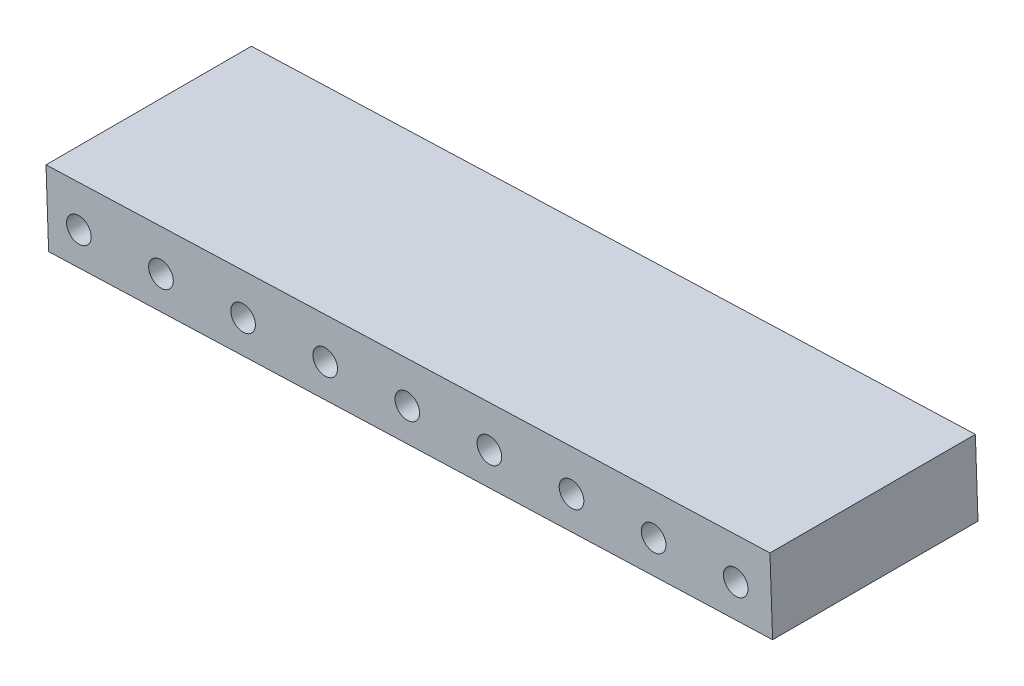
from build123d import *
from build123d.topology import SkipClean

# Parameters (mm, degrees)
EXTRUDE_3_DEPTH           = 5
SKETCH_4_R                = 1.5
SKETCH_4_R_2              = 4
CUT_EXTRUDE_3_DEPTH       = 5
SKETCH_5_R                = 11
CUT_EXTRUDE_4_DEPTH       = 2
SKETCH_6_R                = 1.5
CUT_EXTRUDE_6_DEPTH       = 169.745370307
SKETCH_7_R                = 1.5
CUT_EXTRUDE_7_DEPTH       = 10
SKETCH_8_R                = 11
CUT_EXTRUDE_8_DEPTH       = 10
SKETCH_9_R                = 1.5
CUT_EXTRUDE_9_DEPTH       = 10
SKETCH_10_R               = 5
CUT_EXTRUDE_10_DEPTH      = 10
SKETCH_11_R               = 1.5
SKETCH_11_R_2             = 2
CUT_EXTRUDE_11_DEPTH      = 10
SKETCH_12_W               = 41
SKETCH_12_H               = 22
CUT_EXTRUDE_12_DEPTH      = 10
SKETCH_13_R               = 1.5
CUT_EXTRUDE_13_DEPTH      = 10
EXTRUDE_4_DEPTH           = 5
SKETCH_15_R               = 1.5
EXTRUDE_6_DEPTH           = 5
SKETCH_16_R               = 1.5
CUT_EXTRUDE_14_DEPTH      = 5
EXTRUDE_7_DEPTH           = 5
CUT_EXTRUDE_15_DEPTH      = 5
CUT_EXTRUDE_19_DEPTH      = 5
SKETCH_21_R               = 1.5
CUT_EXTRUDE_20_DEPTH      = 5
EXTRUDE_8_DEPTH           = 10
SKETCH_23_R               = 1.5
CUT_EXTRUDE_21_DEPTH      = 15
CUT_EXTRUDE_25_DEPTH      = 138.493760399
CUT_EXTRUDE_25_DEPTH_BACK = 138.493760399
SKETCH_24_W               = 0.175432459
SKETCH_24_H               = 19.473002918
SKETCH_24_W_2             = 262.974480033
SKETCH_24_H_2             = 55.221701651
SKETCH_25_R               = 1.5
EXTRUDE_9_DEPTH           = 10
CUT_EXTRUDE_28_DEPTH      = 139.940757694
CUT_EXTRUDE_28_DEPTH_BACK = 139.940757694
SKETCH_26_R               = 1.5
CUT_EXTRUDE_29_DEPTH      = 25


with BuildPart() as part:
    # 草图1 → 凸台-拉伸3 (new body)
    with BuildSketch(Plane.XY):
        with BuildLine():
            Line((140, 25), (0, 35))
            ThreePointArc((0, 35), (-35, 0), (0, -35))
            Line((0, -35), (140, -25))
            ThreePointArc((140, -25), (165, 0), (140, 25))
        make_face()
    extrude(amount=EXTRUDE_3_DEPTH)

    # 草图4 → 切除-拉伸3 (cut)
    with BuildSketch(Plane.XY.offset(5)):
        with Locations((-5, -5)):
            Circle(SKETCH_4_R)
        with Locations((5, -5)):
            Circle(SKETCH_4_R)
        with Locations((-5, 5)):
            Circle(SKETCH_4_R)
        with Locations((5, 5)):
            Circle(SKETCH_4_R)
        with Locations((135, -5)):
            Circle(SKETCH_4_R)
        with Locations((145, -5)):
            Circle(SKETCH_4_R)
        with Locations((135, 5)):
            Circle(SKETCH_4_R)
        with Locations((145, 5)):
            Circle(SKETCH_4_R)
        Circle(SKETCH_4_R_2)
        with Locations((140, 0)):
            Circle(SKETCH_4_R_2)
    extrude(amount=-CUT_EXTRUDE_3_DEPTH, mode=Mode.SUBTRACT)

    # 草图5 → 切除-拉伸4 (cut)
    with BuildSketch(Plane.XY.offset(5)):
        Circle(SKETCH_5_R)
        with Locations((140, 0)):
            Circle(SKETCH_5_R)
    extrude(amount=-CUT_EXTRUDE_4_DEPTH, mode=Mode.SUBTRACT)

    # 草图6 → 切除-拉伸6 (cut, through all)
    with BuildSketch(Plane.XY.offset(5)):
        with Locations((30, 0)):
            Circle(SKETCH_6_R)
        with Locations((25.980762114, 15)):
            Circle(SKETCH_6_R)
        with Locations((25.980762114, -15)):
            Circle(SKETCH_6_R)
        with Locations((15, 25.980762114)):
            Circle(SKETCH_6_R)
        with Locations((15, -25.980762114)):
            Circle(SKETCH_6_R)
        with Locations((0, 30)):
            Circle(SKETCH_6_R)
        with Locations((0, -30)):
            Circle(SKETCH_6_R)
        with Locations((-15, 25.980762114)):
            Circle(SKETCH_6_R)
        with Locations((-15, -25.980762114)):
            Circle(SKETCH_6_R)
        with Locations((-25.980762114, 15)):
            Circle(SKETCH_6_R)
        with Locations((-25.980762114, -15)):
            Circle(SKETCH_6_R)
        with Locations((-30, 0)):
            Circle(SKETCH_6_R)
        with Locations((160, 0)):
            Circle(SKETCH_6_R)
        with Locations((157.320508076, 10)):
            Circle(SKETCH_6_R)
        with Locations((157.320508076, -10)):
            Circle(SKETCH_6_R)
        with Locations((150, 17.320508076)):
            Circle(SKETCH_6_R)
        with Locations((150, -17.320508076)):
            Circle(SKETCH_6_R)
        with Locations((140, 20)):
            Circle(SKETCH_6_R)
        with Locations((140, -20)):
            Circle(SKETCH_6_R)
        with Locations((130, 17.320508076)):
            Circle(SKETCH_6_R)
        with Locations((130, -17.320508076)):
            Circle(SKETCH_6_R)
        with Locations((122.679491924, 10)):
            Circle(SKETCH_6_R)
        with Locations((122.679491924, -10)):
            Circle(SKETCH_6_R)
        with Locations((120, 0)):
            Circle(SKETCH_6_R)
    extrude(amount=-CUT_EXTRUDE_6_DEPTH, mode=Mode.SUBTRACT)

    # 草图7 → 切除-拉伸7 (cut)
    with SkipClean():  # the faces are left unmerged after this step: merging them gives an invalid solid
        with BuildSketch(Plane.XY.offset(5)):
            with BuildLine():
                ThreePointArc((138.21656051, 24.936305732), (139.107711737, 24.984071359), (140, 25))
                Line((140, 25), (0, 35))
                ThreePointArc((0, 35), (-35, 0), (0, -35))
                Line((0, -35), (140, -25))
                ThreePointArc((140, -25), (139.107711737, -24.984071359), (138.21656051, -24.936305732))
                Line((138.21656051, -24.936305732), (0, -20))
                ThreePointArc((0, -20), (-20, 0), (0, 20))
                Line((0, 20), (138.21656051, 24.936305732))
            make_face()
            with Locations((0, -30)):
                Circle(SKETCH_7_R, mode=Mode.SUBTRACT)
            with Locations((-15, -25.980762114)):
                Circle(SKETCH_7_R, mode=Mode.SUBTRACT)
            with Locations((15, -25.980762114)):
                Circle(SKETCH_7_R, mode=Mode.SUBTRACT)
            with Locations((-25.980762114, -15)):
                Circle(SKETCH_7_R, mode=Mode.SUBTRACT)
            with Locations((-30, 0)):
                Circle(SKETCH_7_R, mode=Mode.SUBTRACT)
            with Locations((-25.980762114, 15)):
                Circle(SKETCH_7_R, mode=Mode.SUBTRACT)
            with Locations((-15, 25.980762114)):
                Circle(SKETCH_7_R, mode=Mode.SUBTRACT)
            with Locations((0, 30)):
                Circle(SKETCH_7_R, mode=Mode.SUBTRACT)
            with Locations((15, 25.980762114)):
                Circle(SKETCH_7_R, mode=Mode.SUBTRACT)
        extrude(amount=-CUT_EXTRUDE_7_DEPTH, mode=Mode.SUBTRACT)

    # 草图8 → 切除-拉伸8 (cut)
    with SkipClean():  # the faces are left unmerged after this step: merging them gives an invalid solid
        with BuildSketch(Plane.XY.offset(5)):
            Circle(SKETCH_8_R)
        extrude(amount=-CUT_EXTRUDE_8_DEPTH, mode=Mode.SUBTRACT)

    # 草图9 → 切除-拉伸9 (cut)
    with SkipClean():  # the faces are left unmerged after this step: merging them gives an invalid solid
        with BuildSketch(Plane.XY.offset(5)):
            with Locations((15, 0)):
                Circle(SKETCH_9_R)
            with Locations((10.606601718, 10.606601718)):
                Circle(SKETCH_9_R)
            with Locations((10.606601718, -10.606601718)):
                Circle(SKETCH_9_R)
            with Locations((0, 15)):
                Circle(SKETCH_9_R)
            with Locations((0, -15)):
                Circle(SKETCH_9_R)
            with Locations((-10.606601718, 10.606601718)):
                Circle(SKETCH_9_R)
            with Locations((-10.606601718, -10.606601718)):
                Circle(SKETCH_9_R)
            with Locations((-15, 0)):
                Circle(SKETCH_9_R)
        extrude(amount=-CUT_EXTRUDE_9_DEPTH, mode=Mode.SUBTRACT)

    # 草图10 → 切除-拉伸10 (cut)
    with SkipClean():  # the faces are left unmerged after this step: merging them gives an invalid solid
        with BuildSketch(Plane.XY.offset(3)):
            with Locations((140, 0)):
                Circle(SKETCH_10_R)
        extrude(amount=-CUT_EXTRUDE_10_DEPTH, mode=Mode.SUBTRACT)

    # 草图11 → 切除-拉伸11 (cut)
    # profile 1 of 5: a face of its own
    with SkipClean():  # the faces are left unmerged after this step: merging them gives an invalid solid
        with BuildSketch(Plane.XY.offset(5)):
            with BuildLine():
                Line((124.179491924, -10), (150, -10))
                Line((150, -10), (150, 10))
                Line((150, 10), (124.179491924, 10))
                ThreePointArc((124.179491924, 10), (122.679491924, 8.5), (121.179491924, 10))
                Line((121.179491924, 10), (110, 10))
                Line((110, 10), (110, -10))
                Line((110, -10), (121.179491924, -10))
                ThreePointArc((121.179491924, -10), (122.679491924, -8.5), (124.179491924, -10))
            make_face()
            with Locations((120, 0)):
                Circle(SKETCH_11_R, mode=Mode.SUBTRACT)
        # profile 2 of 5: a face of its own
        with BuildSketch(Plane.XY.offset(5)):
            with Locations((105.5, 5)):
                Circle(SKETCH_11_R_2)
        # profile 3 of 5: a face of its own
        with BuildSketch(Plane.XY.offset(5)):
            with Locations((105.5, -5)):
                Circle(SKETCH_11_R_2)
        # profile 4 of 5: a face of its own
        with BuildSketch(Plane.XY.offset(5)):
            with Locations((154.5, -5)):
                Circle(SKETCH_11_R_2)
        # profile 5 of 5: a face of its own
        with BuildSketch(Plane.XY.offset(5)):
            with Locations((154.5, 5)):
                Circle(SKETCH_11_R_2)
        extrude(amount=-CUT_EXTRUDE_11_DEPTH, mode=Mode.SUBTRACT)

    # 草图12 → 切除-拉伸12 (cut)
    with SkipClean():  # the faces are left unmerged after this step: merging them gives an invalid solid
        with BuildSketch(Plane.XY.offset(5)):
            with Locations((130, 0)):
                Rectangle(SKETCH_12_W, SKETCH_12_H)
        extrude(amount=-CUT_EXTRUDE_12_DEPTH, mode=Mode.SUBTRACT)

    # 草图13 → 切除-拉伸13 (cut)
    with SkipClean():  # the faces are left unmerged after this step: merging them gives an invalid solid
        with BuildSketch(Plane.XY.offset(5)):
            with BuildLine():
                ThreePointArc((129.008722028, -18.446282468), (129.863637935, -21.138943397), (130.908449037, -18.514124575))
                ThreePointArc((130.908449037, -18.514124575), (129.94646687, -18.819552506), (129.008722028, -18.446282468))
            make_face()
            with Locations((119.923542522, -19.282983661)):
                Circle(SKETCH_13_R)
            with Locations((109.929913978, -18.926068356)):
                Circle(SKETCH_13_R)
            with Locations((99.936285435, -18.569153051)):
                Circle(SKETCH_13_R)
            with Locations((89.942656891, -18.212237746)):
                Circle(SKETCH_13_R)
            with Locations((79.949028348, -17.855322441)):
                Circle(SKETCH_13_R)
            with Locations((69.955399804, -17.498407136)):
                Circle(SKETCH_13_R)
            with Locations((59.961771261, -17.141491831)):
                Circle(SKETCH_13_R)
            with Locations((49.968142717, -16.784576526)):
                Circle(SKETCH_13_R)
            with Locations((39.974514174, -16.42766122)):
                Circle(SKETCH_13_R)
            with Locations((29.98088563, -16.070745915)):
                Circle(SKETCH_13_R)
            with Locations((19.987257087, -15.71383061)):
                Circle(SKETCH_13_R)
            with Locations((9.993628543, -15.356915305)):
                Circle(SKETCH_13_R)
        extrude(amount=-CUT_EXTRUDE_13_DEPTH, mode=Mode.SUBTRACT)

    # 草图14 → 凸台-拉伸4 (add)
    with SkipClean():  # the faces are left unmerged after this step: merging them gives an invalid solid
        with BuildSketch(Plane.XY.offset(5)):
            with BuildLine():
                ThreePointArc((130.908449037, -18.514124575), (131.344000289, -17.986588568), (131.5, -17.320508076))
                ThreePointArc((131.5, -17.320508076), (129.382309527, -15.953592395), (129.008722028, -18.446282468))
                ThreePointArc((129.008722028, -18.446282468), (129.970704195, -18.140854536), (130.908449037, -18.514124575))
            make_face()
        extrude(amount=-EXTRUDE_4_DEPTH)

    # 草图15 → 凸台-拉伸6 (add)
    with SkipClean():  # the faces are left unmerged after this step: merging them gives an invalid solid
        with BuildSketch(Plane.XY.offset(5)):
            with Locations((25.980762114, 15)):
                Circle(SKETCH_15_R)
            with Locations((30, 0)):
                Circle(SKETCH_15_R)
            with Locations((25.980762114, -15)):
                Circle(SKETCH_15_R)
        extrude(amount=-EXTRUDE_6_DEPTH)

    # 草图16 → 切除-拉伸14 (cut)
    with SkipClean():  # the faces are left unmerged after this step: merging them gives an invalid solid
        with BuildSketch(Plane.XY.offset(5)):
            with Locations((129.917171065, 19.639898967)):
                Circle(SKETCH_16_R)
            with Locations((119.923542522, 19.282983661)):
                Circle(SKETCH_16_R)
            with Locations((109.929913978, 18.926068356)):
                Circle(SKETCH_16_R)
            with Locations((99.936285435, 18.569153051)):
                Circle(SKETCH_16_R)
            with Locations((89.942656891, 18.212237746)):
                Circle(SKETCH_16_R)
            with Locations((79.949028348, 17.855322441)):
                Circle(SKETCH_16_R)
            with Locations((69.955399804, 17.498407136)):
                Circle(SKETCH_16_R)
            with Locations((59.961771261, 17.141491831)):
                Circle(SKETCH_16_R)
            with Locations((49.968142717, 16.784576526)):
                Circle(SKETCH_16_R)
            with Locations((39.974514174, 16.42766122)):
                Circle(SKETCH_16_R)
            with Locations((29.98088563, 16.070745915)):
                Circle(SKETCH_16_R)
            with Locations((19.987257087, 15.71383061)):
                Circle(SKETCH_16_R)
            with Locations((9.993628543, 15.356915305)):
                Circle(SKETCH_16_R)
        extrude(amount=-CUT_EXTRUDE_14_DEPTH, mode=Mode.SUBTRACT)

    # 草图17 → 凸台-拉伸7 (add)
    with SkipClean():  # the faces are left unmerged after this step: merging them gives an invalid solid
        with BuildSketch(Plane.XY.offset(5)):
            with BuildLine():
                ThreePointArc((129.008722028, 18.446282468), (129.382309527, 15.953592395), (131.5, 17.320508076))
                ThreePointArc((131.5, 17.320508076), (131.344000289, 17.986588568), (130.908449037, 18.514124575))
                ThreePointArc((130.908449037, 18.514124575), (129.970704195, 18.140854536), (129.008722028, 18.446282468))
            make_face()
        extrude(amount=-EXTRUDE_7_DEPTH)

    # 草图18 → 切除-拉伸15 (cut)
    with SkipClean():  # the faces are left unmerged after this step: merging them gives an invalid solid
        with BuildSketch(Plane.XY.offset(5)):
            with BuildLine():
                ThreePointArc((100, 0), (99.769776761, 6.781714021), (99.080167099, 13.532201878))
                Line((99.080167099, 13.532201878), (22.547372848, 10.798887797))
                ThreePointArc((22.547372848, 10.798887797), (24.379133713, 5.536952176), (25, 0))
                ThreePointArc((25, 0), (24.379133713, -5.536952176), (22.547372848, -10.798887797))
                Line((22.547372848, -10.798887797), (99.080167099, -13.532201878))
                ThreePointArc((99.080167099, -13.532201878), (99.769776761, -6.781714021), (100, 0))
            make_face()
        extrude(amount=-CUT_EXTRUDE_15_DEPTH, mode=Mode.SUBTRACT)

    # 草图19 → 切除-拉伸19 (cut)
    with SkipClean():  # the faces are left unmerged after this step: merging them gives an invalid solid
        with BuildSketch(Plane.XY.offset(5)):
            with BuildLine():
                Line((134.406294114, 15.794486823), (16.308878209, 11.576721969))
                Line((16.308878209, 11.576721969), (15.987654435, 20.570987658))
                Line((15.987654435, 20.570987658), (0, 20))
                ThreePointArc((0, 20), (-20, 0), (0, -20))
                Line((0, -20), (15.987654435, -20.570987658))
                Line((15.987654435, -20.570987658), (16.308878209, -11.576721969))
                Line((16.308878209, -11.576721969), (134.406294114, -15.794486823))
                ThreePointArc((134.406294114, -15.794486823), (156.755756012, 0), (134.406294114, 15.794486823))
            make_face()
        extrude(amount=-CUT_EXTRUDE_19_DEPTH, mode=Mode.SUBTRACT)

    # 草图21 → 切除-拉伸20 (cut)
    with SkipClean():  # the faces are left unmerged after this step: merging them gives an invalid solid
        with BuildSketch(Plane.XY.offset(5)):
            with BuildLine():
                ThreePointArc((134.406294114, 15.794486823), (146.604776394, 15.399100244), (155.298987649, 6.833471771))
                ThreePointArc((155.298987649, 6.833471771), (156.390745963, 5.651981367), (156.259259804, 4.048682523))
                ThreePointArc((156.259259804, 4.048682523), (156.755756012, 0), (156.259259804, -4.048682523))
                ThreePointArc((156.259259804, -4.048682523), (156.390745963, -5.651981367), (155.298987649, -6.833471771))
                ThreePointArc((155.298987649, -6.833471771), (146.604776394, -15.399100244), (134.406294114, -15.794486823))
                Line((134.406294114, -15.794486823), (134.08507034, -24.788752512))
                Line((134.08507034, -24.788752512), (138.21656051, -24.936305732))
                ThreePointArc((138.21656051, -24.936305732), (165, 0), (138.21656051, 24.936305732))
                Line((138.21656051, 24.936305732), (134.08507034, 24.788752512))
                Line((134.08507034, 24.788752512), (134.406294114, 15.794486823))
            make_face()
            with Locations((140, -20)):
                Circle(SKETCH_21_R, mode=Mode.SUBTRACT)
            with Locations((150, -17.320508076)):
                Circle(SKETCH_21_R, mode=Mode.SUBTRACT)
            with Locations((157.320508076, -10)):
                Circle(SKETCH_21_R, mode=Mode.SUBTRACT)
            with Locations((160, 0)):
                Circle(SKETCH_21_R, mode=Mode.SUBTRACT)
            with Locations((157.320508076, 10)):
                Circle(SKETCH_21_R, mode=Mode.SUBTRACT)
            with Locations((150, 17.320508076)):
                Circle(SKETCH_21_R, mode=Mode.SUBTRACT)
            with Locations((140, 20)):
                Circle(SKETCH_21_R, mode=Mode.SUBTRACT)
        extrude(amount=-CUT_EXTRUDE_20_DEPTH, mode=Mode.SUBTRACT)


with BuildPart() as cut_extrude_20_piece_1:
    # of the separate pieces the step leaves, piece 1, a body of its own (cut_extrude_20_pieces)
    add(part.part.solids().sort_by_distance((134.08507034, 24.788752512, 0))[0])



with BuildPart() as cut_extrude_20_piece_2:
    # of the separate pieces the step leaves, piece 2, a body of its own (cut_extrude_20_pieces)
    add(part.part.solids().sort_by_distance((134.08507034, -24.788752512, 0))[0])


with BuildPart() as cut_extrude_20_piece_1_1:
    with SkipClean():  # the faces are left unmerged after this step: merging them gives an invalid solid
        add(cut_extrude_20_piece_1.part)

        add(cut_extrude_20_piece_2.part)  # 凸台-拉伸8 merges 切除-拉伸20 piece 2
        # 草图22 → 凸台-拉伸8 (add)
        with BuildSketch(Plane(origin=(0, 0, 0), x_dir=(-1, 0, 0), z_dir=(0, 0, -1))):
            Polygon((-134.08507034, 24.788752512), (-134.406294114, 15.794486823), (-16.308878209, 11.576721969), (-15.987654435, 20.570987658), align=None)
            Polygon((-134.406294114, -15.794486823), (-134.08507034, -24.788752512), (-15.987654435, -20.570987658), (-16.308878209, -11.576721969), align=None)
        extrude(amount=EXTRUDE_8_DEPTH)

    # 草图23 → 切除-拉伸21 (cut)
    with SkipClean():  # the faces are left unmerged after this step: merging them gives an invalid solid
        with BuildSketch(Plane.XY.offset(5)):
            with Locations((19.987257087, 15.71383061)):
                Circle(SKETCH_23_R)
            with Locations((29.98088563, 16.070745915)):
                Circle(SKETCH_23_R)
            with Locations((39.974514174, 16.42766122)):
                Circle(SKETCH_23_R)
            with Locations((49.968142717, 16.784576526)):
                Circle(SKETCH_23_R)
            with Locations((59.961771261, 17.141491831)):
                Circle(SKETCH_23_R)
            with Locations((69.955399804, 17.498407136)):
                Circle(SKETCH_23_R)
            with Locations((79.949028348, 17.855322441)):
                Circle(SKETCH_23_R)
            with Locations((89.942656891, 18.212237746)):
                Circle(SKETCH_23_R)
            with Locations((99.936285435, 18.569153051)):
                Circle(SKETCH_23_R)
            with Locations((109.929913978, 18.926068356)):
                Circle(SKETCH_23_R)
            with Locations((119.923542522, 19.282983661)):
                Circle(SKETCH_23_R)
            with Locations((129.917171065, 19.639898967)):
                Circle(SKETCH_23_R)
            with Locations((129.917171065, -19.639898967)):
                Circle(SKETCH_23_R)
            with Locations((119.923542522, -19.282983661)):
                Circle(SKETCH_23_R)
            with Locations((109.929913978, -18.926068356)):
                Circle(SKETCH_23_R)
            with Locations((99.936285435, -18.569153051)):
                Circle(SKETCH_23_R)
            with Locations((89.942656891, -18.212237746)):
                Circle(SKETCH_23_R)
            with Locations((79.949028348, -17.855322441)):
                Circle(SKETCH_23_R)
            with Locations((69.955399804, -17.498407136)):
                Circle(SKETCH_23_R)
            with Locations((59.961771261, -17.141491831)):
                Circle(SKETCH_23_R)
            with Locations((49.968142717, -16.784576526)):
                Circle(SKETCH_23_R)
            with Locations((39.974514174, -16.42766122)):
                Circle(SKETCH_23_R)
            with Locations((29.98088563, -16.070745915)):
                Circle(SKETCH_23_R)
            with Locations((19.987257087, -15.71383061)):
                Circle(SKETCH_23_R)
        extrude(amount=-CUT_EXTRUDE_21_DEPTH, mode=Mode.SUBTRACT)

    # 草图24 → 切除-拉伸25 (cut, two sides: drawn at the far end of the back side and taken through both)
    with BuildSketch(Plane(origin=(0, 0, -10), x_dir=(-1, 0, 0), z_dir=(0, 0, -1)).offset(-CUT_EXTRUDE_25_DEPTH_BACK)):
        with Locations((-138.96667302, 3.070068028)):
            Rectangle(SKETCH_24_W, SKETCH_24_H)
        with Locations((-141.773592358, -35.437356662)):
            Rectangle(SKETCH_24_W_2, SKETCH_24_H_2)
    extrude(amount=CUT_EXTRUDE_25_DEPTH + CUT_EXTRUDE_25_DEPTH_BACK, mode=Mode.SUBTRACT)

    # 草图25 → 凸台-拉伸9 (add)
    with SkipClean():  # the faces are left unmerged after this step: merging them gives an invalid solid
        with BuildSketch(Plane(origin=(0, 0, -10), x_dir=(-1, 0, 0), z_dir=(0, 0, -1))):
            Polygon((-134.08507034, 24.788752512), (-134.406294114, 15.794486823), (-16.308878209, 11.576721969), (-15.987654435, 20.570987658), align=None)
            with Locations((-129.917171065, 19.639898967)):
                Circle(SKETCH_25_R, mode=Mode.SUBTRACT)
            with Locations((-119.923542522, 19.282983661)):
                Circle(SKETCH_25_R, mode=Mode.SUBTRACT)
            with Locations((-109.929913978, 18.926068356)):
                Circle(SKETCH_25_R, mode=Mode.SUBTRACT)
            with Locations((-99.936285435, 18.569153051)):
                Circle(SKETCH_25_R, mode=Mode.SUBTRACT)
            with Locations((-89.942656891, 18.212237746)):
                Circle(SKETCH_25_R, mode=Mode.SUBTRACT)
            with Locations((-79.949028348, 17.855322441)):
                Circle(SKETCH_25_R, mode=Mode.SUBTRACT)
            with Locations((-69.955399804, 17.498407136)):
                Circle(SKETCH_25_R, mode=Mode.SUBTRACT)
            with Locations((-59.961771261, 17.141491831)):
                Circle(SKETCH_25_R, mode=Mode.SUBTRACT)
            with Locations((-49.968142717, 16.784576526)):
                Circle(SKETCH_25_R, mode=Mode.SUBTRACT)
            with Locations((-39.974514174, 16.42766122)):
                Circle(SKETCH_25_R, mode=Mode.SUBTRACT)
            with Locations((-29.98088563, 16.070745915)):
                Circle(SKETCH_25_R, mode=Mode.SUBTRACT)
            with Locations((-19.987257087, 15.71383061)):
                Circle(SKETCH_25_R, mode=Mode.SUBTRACT)
        extrude(amount=EXTRUDE_9_DEPTH)

    # 草图26 → 切除-拉伸28 (cut, two sides: drawn at the far end of the back side and taken through both)
    with SkipClean():  # the faces are left unmerged after this step: merging them gives an invalid solid
        with BuildSketch(Plane(origin=(0, 0, -20), x_dir=(-1, 0, 0), z_dir=(0, 0, -1)).offset(-CUT_EXTRUDE_28_DEPTH_BACK)):
            Polygon((-114.419037027, 15.080656213), (-114.097813253, 24.074921902), (-134.08507034, 24.788752512), (-134.406294114, 15.794486823), align=None)
            with Locations((-129.917171065, 19.639898967)):
                Circle(SKETCH_26_R, mode=Mode.SUBTRACT)
            with Locations((-119.923542522, 19.282983661)):
                Circle(SKETCH_26_R, mode=Mode.SUBTRACT)
        extrude(amount=CUT_EXTRUDE_28_DEPTH + CUT_EXTRUDE_28_DEPTH_BACK, mode=Mode.SUBTRACT)

    # 草图27 → 切除-拉伸29 (cut)
    with SkipClean():  # the faces are left unmerged after this step: merging them gives an invalid solid
        with BuildSketch(Plane(origin=(0, 0, -20), x_dir=(-1, 0, 0), z_dir=(0, 0, -1))):
            Polygon((-16.308878209, 11.576721969), (-15.987654435, 20.570987658), (-25.981282978, 20.927902964), (-26.302506753, 11.933637274), align=None)
        extrude(amount=-CUT_EXTRUDE_29_DEPTH, mode=Mode.SUBTRACT)


solid = cut_extrude_20_piece_1_1.part
